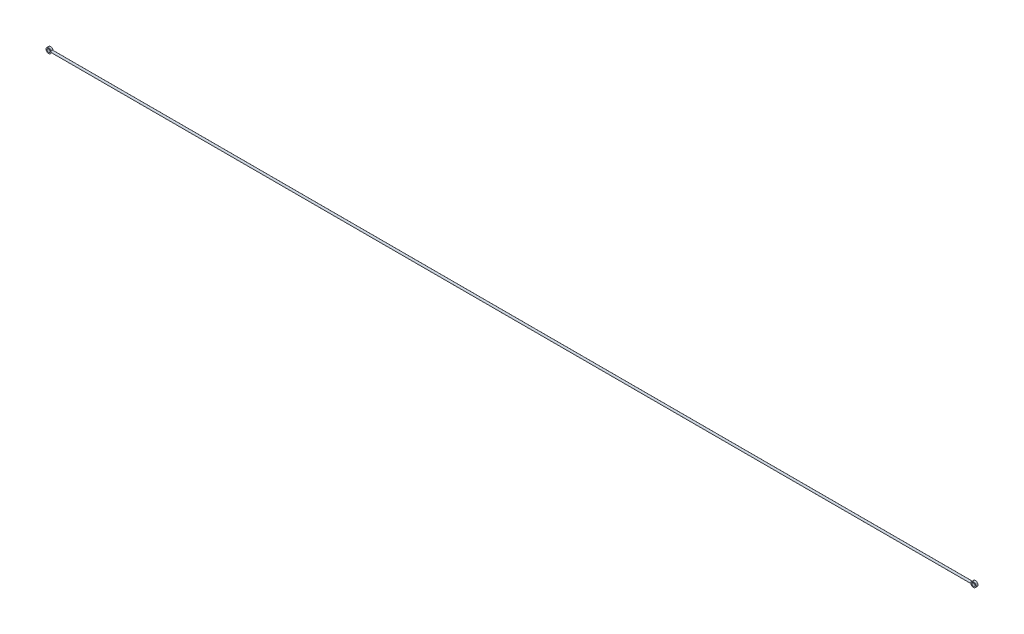
from build123d import *
from build123d.topology import SkipClean

# Parameters (mm, degrees)
CROQUIS2_R                   = 0.5
SALIENTE_EXTRUIR1_DEPTH      = 0.5
SALIENTE_EXTRUIR1_DEPTH_BACK = 0.5
CROQUIS3_R                   = 1.25
CROQUIS3_R_2                 = 0.75


with BuildPart() as part:
    # Barrer1: sweep along a path in Croquis1
    with BuildLine(Plane.XY) as barrer1_path:
        Line((0, 0), (-450, 0))
    # Croquis2 → Barrer1 (sweep)
    with BuildSketch(Plane(origin=(0, 0, 0), x_dir=(0, 0, -1), z_dir=(1, 0, 0))):
        Circle(CROQUIS2_R)
    sweep(path=barrer1_path.line)

    # Croquis3 → Saliente-Extruir1 (add, two sides: drawn at the far end of the back side and taken through both)
    # profile 1 of 2: a face of its own
    with SkipClean():  # the faces are left unmerged after this step: merging them gives an invalid solid
        with BuildSketch(Plane.XY.offset(-SALIENTE_EXTRUIR1_DEPTH_BACK)):
            with Locations((1, 0)):
                Circle(CROQUIS3_R)
            with Locations((1, 0)):
                Circle(CROQUIS3_R_2, mode=Mode.SUBTRACT)
        # profile 2 of 2: a face of its own
        with BuildSketch(Plane.XY.offset(-SALIENTE_EXTRUIR1_DEPTH_BACK)):
            with Locations((-451, 0)):
                Circle(CROQUIS3_R)
            with Locations((-451, 0)):
                Circle(CROQUIS3_R_2, mode=Mode.SUBTRACT)
        extrude(amount=SALIENTE_EXTRUIR1_DEPTH + SALIENTE_EXTRUIR1_DEPTH_BACK)


solid = part.part
